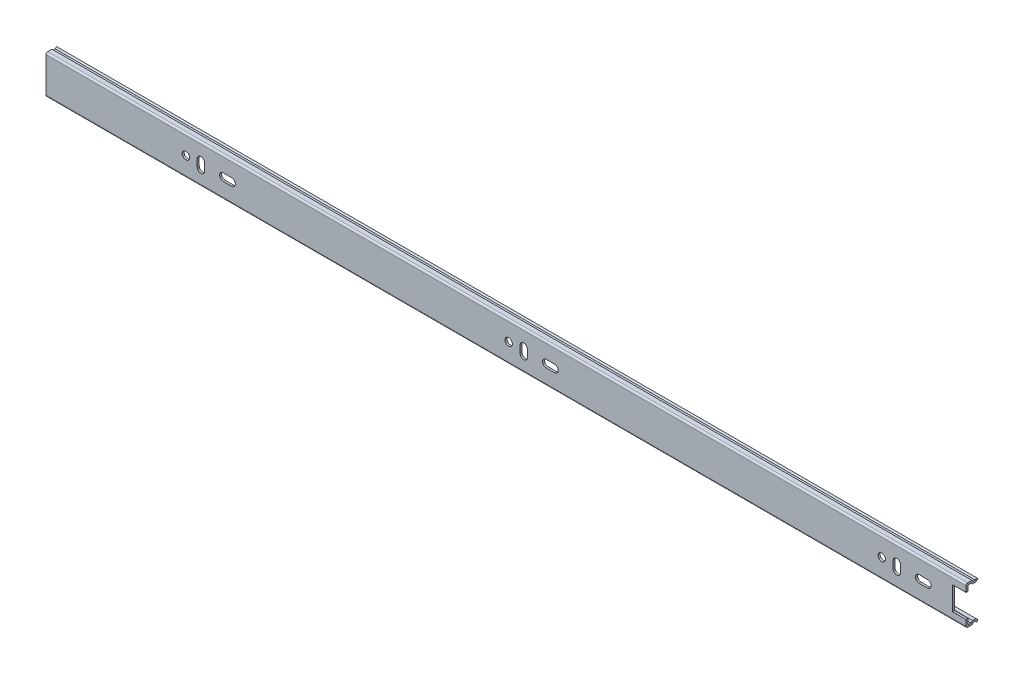
from build123d import *

# Parameters (mm, degrees)
EXTRUDE_3_DEPTH     = 550
SKETCH_2_R          = 2.2
SKETCH_2_W          = 8.2
SKETCH_2_H          = 14
CUT_EXTRUDE_1_DEPTH = 551.166657891


with BuildPart() as part:
    # Эскиз1 → Вытянуть-Тонкостенный3 (new body)
    with BuildSketch(Plane(origin=(0, 0, 0), x_dir=(0, 0, -1), z_dir=(1, 0, 0))):
        with BuildLine():
            Line((6.3, 11.5), (5.501920783, 10.701920783))
            Line((5.501920783, 10.701920783), (4.371381229, 10.701920783))
            Line((4.371381229, 10.701920783), (3.573302011, 11.5))
            Line((3.573302011, 11.5), (1, 11.5))
            ThreePointArc((1, 11.5), (0.292893219, 11.207106781), (0, 10.5))
            Line((0, 10.5), (0, -10.5))
            ThreePointArc((0, -10.5), (0.292893219, -11.207106781), (1, -11.5))
            Line((1, -11.5), (3.573302011, -11.5))
            Line((3.573302011, -11.5), (4.371381229, -10.701920783))
            Line((4.371381229, -10.701920783), (5.501920783, -10.701920783))
            Line((5.501920783, -10.701920783), (6.3, -11.5))
            Line((6.3, -11.5), (7.148528137, -10.651471863))
            Line((7.148528137, -10.651471863), (5.998977057, -9.501920783))
            Line((5.998977057, -9.501920783), (3.874324954, -9.501920783))
            Line((3.874324954, -9.501920783), (3.076245737, -10.3))
            Line((3.076245737, -10.3), (1.2, -10.3))
            Line((1.2, -10.3), (1.2, 10.3))
            Line((1.2, 10.3), (3.076245737, 10.3))
            Line((3.076245737, 10.3), (3.874324954, 9.501920783))
            Line((3.874324954, 9.501920783), (5.998977057, 9.501920783))
            Line((5.998977057, 9.501920783), (7.148528137, 10.651471863))
            Line((7.148528137, 10.651471863), (6.3, 11.5))
        make_face()
    extrude(amount=EXTRUDE_3_DEPTH)

    # Эскиз2 → Вырез-Вытянуть1 (cut, through all)
    with BuildSketch(Plane.XY):
        with Locations((499.6, 0)):
            Circle(SKETCH_2_R)
        with Locations((276.6, 0)):
            Circle(SKETCH_2_R)
        with Locations((83.6, 0)):
            Circle(SKETCH_2_R)
        with Locations((545.9, 0)):
            Rectangle(SKETCH_2_W, SKETCH_2_H)
        with BuildLine():
            Line((522, 2.2), (527, 2.2))
            ThreePointArc((527, 2.2), (529.2, 0), (527, -2.2))
            Line((527, -2.2), (522, -2.2))
            ThreePointArc((522, -2.2), (519.8, 0), (522, 2.2))
        make_face()
        with BuildLine():
            Line((506.4, 1.779598361), (506.4, -2.5))
            ThreePointArc((506.4, -2.5), (508.6, -4.7), (510.8, -2.5))
            Line((510.8, -2.5), (510.8, 1.779598361))
            ThreePointArc((510.8, 1.779598361), (508.6, 3.979598361), (506.4, 1.779598361))
        make_face()
        with BuildLine():
            Line((283.4, 1.779598361), (283.4, -2.5))
            ThreePointArc((283.4, -2.5), (285.6, -4.7), (287.8, -2.5))
            Line((287.8, -2.5), (287.8, 1.779598361))
            ThreePointArc((287.8, 1.779598361), (285.6, 3.979598361), (283.4, 1.779598361))
        make_face()
        with BuildLine():
            Line((299, -2.2), (304, -2.2))
            ThreePointArc((304, -2.2), (306.2, 0), (304, 2.2))
            Line((304, 2.2), (299, 2.2))
            ThreePointArc((299, 2.2), (296.8, 0), (299, -2.2))
        make_face()
        with BuildLine():
            Line((94.8, -2.5), (94.8, 1.779598361))
            ThreePointArc((94.8, 1.779598361), (92.6, 3.979598361), (90.4, 1.779598361))
            Line((90.4, 1.779598361), (90.4, -2.5))
            ThreePointArc((90.4, -2.5), (92.6, -4.7), (94.8, -2.5))
        make_face()
        with BuildLine():
            Line((106, 2.2), (111, 2.2))
            ThreePointArc((111, 2.2), (113.2, 0), (111, -2.2))
            Line((111, -2.2), (106, -2.2))
            ThreePointArc((106, -2.2), (103.8, 0), (106, 2.2))
        make_face()
    extrude(amount=-CUT_EXTRUDE_1_DEPTH, mode=Mode.SUBTRACT)


solid = part.part
